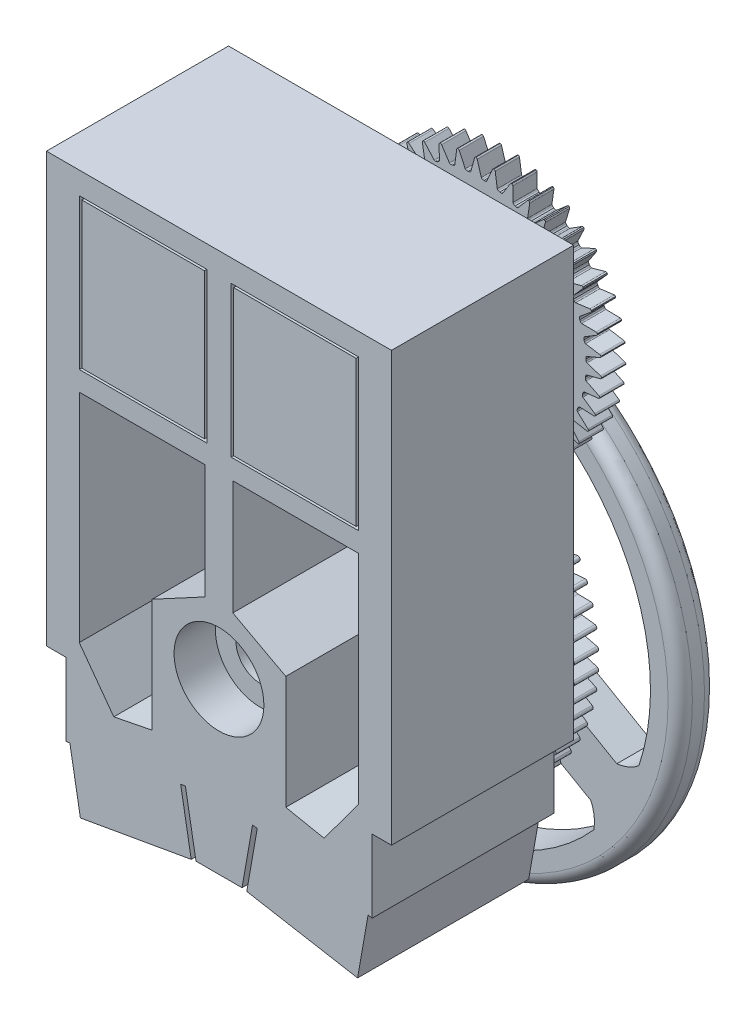
from build123d import *

# Parameters (mm, degrees)
SKETCH_1_R          = 2
SKETCH_1_W          = 10.5
SKETCH_1_H          = 12.4
EXTRUDE_1_DEPTH     = 15
SKETCH_2_R          = 3.7
CUT_EXTRUDE_1_DEPTH = 3.4
CUT_EXTRUDE_START   = -3.4
SKETCH_3_R          = 3.7
CUT_EXTRUDE_2_DEPTH = 3.4
CUT_EXTRUDE_4_DEPTH = 30
SKETCH_5_W          = 10.1
SKETCH_5_H          = 12
EXTRUDE_2_DEPTH     = 15
EXTRUDE_2_2_DEPTH   = 15
SKETCH_6_R          = 2
EXTRUDE_6_DEPTH     = 2
SKETCH_7_R          = 0.632337003
EXTRUDE_8_DEPTH     = 2
SKETCH_9_W          = 9.271295228
SKETCH_9_H          = 14.101544239
EXTRUDE_10_DEPTH    = 5
SKETCH_10_R         = 21
EXTRUDE_11_DEPTH    = 3
FILLET_1_R          = 1


with BuildPart() as part:
    # 草图1 → 凸台-拉伸1 (new body)
    with BuildSketch(Plane.XY):
        Polygon((14.213104702, -21.082041765), (12.6181085, -21.082041765), (12.6181085, -27.087928604), (2.76523262, -25.350600749), (1.896991732, -30.274639514), (-1.896991732, -30.274639514), (-2.76523262, -25.350600749), (-12.6181085, -27.087928604), (-12.6181085, -21.082041765), (-14.213104702, -21.082041765), (-14.213104702, -1.473791553), (-14.213104702, 14.225837354), (14.213104702, 14.225837354), (14.213104702, -1.473791553), align=None)
        with Locations((0, -16.345919829)):
            Circle(SKETCH_1_R, mode=Mode.SUBTRACT)
        with Locations((-6.25, 6.2)):
            Rectangle(SKETCH_1_W, SKETCH_1_H, mode=Mode.SUBTRACT)
        with Locations((6.25, 6.2)):
            Rectangle(SKETCH_1_W, SKETCH_1_H, mode=Mode.SUBTRACT)
    extrude(amount=EXTRUDE_1_DEPTH)

    # 草图2 → 切除-拉伸1 (cut)
    with BuildSketch(Plane.XY.offset(15)):
        with Locations((0, -16.345919829)):
            Circle(SKETCH_2_R)
    extrude(amount=-CUT_EXTRUDE_1_DEPTH, mode=Mode.SUBTRACT)

    # 草图3 → 切除-拉伸2 (cut)
    with BuildSketch(Plane(origin=(0, 0, 0), x_dir=(-1, 0, 0), z_dir=(0, 0, -1)).offset(CUT_EXTRUDE_START)):
        with Locations((0, -16.345919829)):
            Circle(SKETCH_3_R)
    extrude(amount=CUT_EXTRUDE_2_DEPTH, mode=Mode.SUBTRACT)

    # 草图4 → 切除-拉伸4 (cut)
    with BuildSketch(Plane.XY.offset(15)):
        Polygon((-11.511003594, -1.616213485), (-1.141020488, -1.616213485), (-1.141020488, -11.044647916), (-5.502192243, -13.390034656), (-5.502192243, -22.734353252), (-8.66548526, -23.361508048), (-11.511003594, -19.484677398), align=None)
        Polygon((5.502192243, -22.734353252), (8.66548526, -23.361508048), (11.511003594, -19.484677398), (11.511003594, -1.616213485), (1.141020488, -1.616213485), (1.141020488, -11.044647916), (5.502192243, -13.390034656), align=None)
    extrude(amount=-CUT_EXTRUDE_4_DEPTH, mode=Mode.SUBTRACT)

    # 草图9 → 凸台-拉伸10 (add)
    with BuildSketch(Plane(origin=(-4.251826085, -24.113303974, 0), x_dir=(0.9848077530122094, -0.1736481776669234, 0), z_dir=(-0.17364817766692336, -0.9848077530122092, 0))):
        with Locations((12.157249201, 7.949227881)):
            Rectangle(SKETCH_9_W, SKETCH_9_H)
    extrude_10 = extrude(amount=EXTRUDE_10_DEPTH)

    # 镜向4: 凸台-拉伸10 across plane
    add(extrude_10.mirror(Plane(origin=(0, 0, 0), x_dir=(0, 0, 1), z_dir=(1, 0, 0))))


with BuildPart() as body_2:
    # 草图5 → 凸台-拉伸2 (new body)
    with BuildSketch(Plane.XY):
        with Locations((-6.25, 6.2)):
            Rectangle(SKETCH_5_W, SKETCH_5_H)
    extrude(amount=EXTRUDE_2_DEPTH)


with BuildPart() as body_3:
    # 草图5 → Extrude 2 2 (new body)
    with BuildSketch(Plane.XY):
        with Locations((6.25, 6.2)):
            Rectangle(SKETCH_5_W, SKETCH_5_H)
    extrude(amount=EXTRUDE_2_2_DEPTH)


with BuildPart() as body_4:
    # 草图6 → 凸台-拉伸6 (new body)
    with BuildSketch(Plane(origin=(0, 0, 0), x_dir=(-1, 0, 0), z_dir=(0, 0, -1))):
        with BuildLine():
            Line((0.557442462, -2.188166105), (0.208308475, -3.18943574))
            ThreePointArc((0.208308475, -3.18943574), (0.130268656, -3.302440773), (0, -3.345919829))
            ThreePointArc((0, -3.345919829), (-0.130268656, -3.302440773), (-0.208308475, -3.18943574))
            Line((-0.208308475, -3.18943574), (-0.557442462, -2.188166105))
            ThreePointArc((-0.557442462, -2.188166105), (-0.748436646, -2.064897881), (-0.925499507, -2.207455158))
            Line((-0.925499507, -2.207455158), (-1.168059724, -3.239734171))
            ThreePointArc((-1.168059724, -3.239734171), (-1.233859791, -3.360277534), (-1.358870022, -3.417135189))
            ThreePointArc((-1.358870022, -3.417135189), (-1.492969852, -3.387511099), (-1.582394404, -3.283282501))
            Line((-1.582394404, -3.283282501), (-2.034276974, -2.323992365))
            ThreePointArc((-2.034276974, -2.323992365), (-2.23710991, -2.221363746), (-2.398301508, -2.381648188))
            Line((-2.398301508, -2.381648188), (-2.531630417, -3.433626715))
            ThreePointArc((-2.531630417, -3.433626715), (-2.584469811, -3.560387709), (-2.702851981, -3.630001019))
            ThreePointArc((-2.702851981, -3.630001019), (-2.839313758, -3.614556462), (-2.939143288, -3.52024625))
            Line((-2.939143288, -3.52024625), (-3.488823521, -2.613445797))
            ThreePointArc((-3.488823521, -2.613445797), (-3.701272929, -2.532581203), (-3.844827217, -2.7088367))
            Line((-3.844827217, -2.7088367), (-3.867464037, -3.768989045))
            ThreePointArc((-3.867464037, -3.768989045), (-3.90676384, -3.900578849), (-4.017220927, -3.982185117))
            ThreePointArc((-4.017220927, -3.982185117), (-4.154549548, -3.981089306), (-4.263690303, -3.897730763))
            Line((-4.263690303, -3.897730763), (-4.905145788, -3.053355088))
            ThreePointArc((-4.905145788, -3.053355088), (-5.124884028, -2.995140489), (-5.249228194, -3.185435949))
            Line((-5.249228194, -3.185435949), (-5.160924912, -4.242146861))
            ThreePointArc((-5.160924912, -4.242146861), (-5.186254546, -4.37712375), (-5.28757636, -4.469828879))
            ThreePointArc((-5.28757636, -4.469828879), (-5.424267224, -4.483093822), (-5.541523435, -4.41160024))
            Line((-5.541523435, -4.41160024), (-6.267726252, -3.6389005))
            ThreePointArc((-6.267726252, -3.6389005), (-6.492345825, -3.603973707), (-6.596117529, -3.806224213))
            Line((-6.596117529, -3.806224213), (-6.397841613, -4.847916145))
            ThreePointArc((-6.397841613, -4.847916145), (-6.408923562, -4.984801285), (-6.5, -5.087589579))
            ThreePointArc((-6.5, -5.087589579), (-6.634555493, -5.115069941), (-6.758642476, -5.056224621))
            Line((-6.758642476, -5.056224621), (-7.561636195, -4.363666674))
            ThreePointArc((-7.561636195, -4.363666674), (-7.788676122, -4.352410353), (-7.870738419, -4.564400006))
            Line((-7.870738419, -4.564400006), (-7.564662223, -5.579659965))
            ThreePointArc((-7.564662223, -5.579659965), (-7.561375071, -5.716953612), (-7.64120828, -5.828698902))
            ThreePointArc((-7.64120828, -5.828698902), (-7.772154184, -5.870093602), (-7.901712416, -5.824541264))
            Line((-7.901712416, -5.824541264), (-8.772699269, -5.219712922))
            ThreePointArc((-8.772699269, -5.219712922), (-8.999672054, -5.232250399), (-9.059125853, -5.451656596))
            Line((-9.059125853, -5.451656596), (-8.648602811, -6.42936118))
            ThreePointArc((-8.648602811, -6.42936118), (-8.630982572, -6.565559118), (-8.698697883, -6.685037097))
            ThreePointArc((-8.698697883, -6.685037097), (-8.824599527, -6.739892607), (-8.958209542, -6.708132333))
            Line((-8.958209542, -6.708132333), (-9.887646815, -6.197660221))
            ThreePointArc((-9.887646815, -6.197660221), (-10.112065696, -6.233854133), (-10.148259608, -6.458273014))
            Line((-10.148259608, -6.458273014), (-9.637787496, -7.387710287))
            ThreePointArc((-9.637787496, -7.387710287), (-9.606027221, -7.521320302), (-9.660882731, -7.647221946))
            ThreePointArc((-9.660882731, -7.647221946), (-9.780360711, -7.714937257), (-9.916558649, -7.697317018))
            Line((-9.916558649, -7.697317018), (-10.894263232, -7.286793976))
            ThreePointArc((-10.894263232, -7.286793976), (-11.11366943, -7.346247774), (-11.126206907, -7.57322056))
            Line((-11.126206907, -7.57322056), (-10.521378565, -8.444207412))
            ThreePointArc((-10.521378565, -8.444207412), (-10.475826227, -8.573765645), (-10.517220927, -8.704711549))
            ThreePointArc((-10.517220927, -8.704711549), (-10.628966217, -8.784544758), (-10.766259864, -8.781257606))
            Line((-10.766259864, -8.781257606), (-11.781519822, -8.475181409))
            ThreePointArc((-11.781519822, -8.475181409), (-11.993509475, -8.557243706), (-11.982253154, -8.784283634))
            Line((-11.982253154, -8.784283634), (-11.289695208, -9.587277353))
            ThreePointArc((-11.289695208, -9.587277353), (-11.230849888, -9.711364335), (-11.258330249, -9.845919829))
            ThreePointArc((-11.258330249, -9.845919829), (-11.361118544, -9.936996266), (-11.498003683, -9.948078216))
            Line((-11.498003683, -9.948078216), (-12.539695616, -9.7498023))
            ThreePointArc((-12.539695616, -9.7498023), (-12.741946122, -9.853574004), (-12.707019329, -10.078193577))
            Line((-12.707019329, -10.078193577), (-11.934319588, -10.804396394))
            ThreePointArc((-11.934319588, -10.804396394), (-11.862826007, -10.921652605), (-11.876090949, -11.058343469))
            ThreePointArc((-11.876090949, -11.058343469), (-11.968796079, -11.159665283), (-12.103772968, -11.184994917))
            Line((-12.103772968, -11.184994917), (-13.16048388, -11.096691634))
            ThreePointArc((-13.16048388, -11.096691634), (-13.35077934, -11.221035801), (-13.292564741, -11.44077404))
            Line((-13.292564741, -11.44077404), (-12.448189066, -12.082229526))
            ThreePointArc((-12.448189066, -12.082229526), (-12.364830522, -12.19137028), (-12.363734712, -12.328698902))
            ThreePointArc((-12.363734712, -12.328698902), (-12.445340979, -12.439155989), (-12.576930783, -12.478455792))
            Line((-12.576930783, -12.478455792), (-13.637083129, -12.501092611))
            ThreePointArc((-13.637083129, -12.501092611), (-13.813338625, -12.644646899), (-13.732474032, -12.857096307))
            Line((-13.732474032, -12.857096307), (-12.825673579, -13.406776541))
            ThreePointArc((-12.825673579, -13.406776541), (-12.731363367, -13.506606071), (-12.71591881, -13.643067848))
            ThreePointArc((-12.71591881, -13.643067848), (-12.78553212, -13.761450017), (-12.912293113, -13.814289412))
            Line((-12.912293113, -13.814289412), (-13.964271641, -13.94761832))
            ThreePointArc((-13.964271641, -13.94761832), (-14.124556082, -14.108809919), (-14.021927463, -14.311642855))
            Line((-14.021927463, -14.311642855), (-13.062637328, -14.763525425))
            ThreePointArc((-13.062637328, -14.763525425), (-12.95840873, -14.852949977), (-12.92878464, -14.987049806))
            ThreePointArc((-12.92878464, -14.987049806), (-12.985642295, -15.112060038), (-13.106185657, -15.177860105))
            Line((-13.106185657, -15.177860105), (-14.138464671, -15.420420322))
            ThreePointArc((-14.138464671, -15.420420322), (-14.281021947, -15.597483182), (-14.157753723, -15.788477367))
            Line((-14.157753723, -15.788477367), (-13.156484089, -16.137611353))
            ThreePointArc((-13.156484089, -16.137611353), (-13.043479055, -16.215651173), (-13, -16.345919829))
            ThreePointArc((-13, -16.345919829), (-13.043479055, -16.476188485), (-13.156484089, -16.554228304))
            Line((-13.156484089, -16.554228304), (-14.157753723, -16.90336229))
            ThreePointArc((-14.157753723, -16.90336229), (-14.281021947, -17.094356475), (-14.138464671, -17.271419335))
            Line((-14.138464671, -17.271419335), (-13.106185657, -17.513979553))
            ThreePointArc((-13.106185657, -17.513979553), (-12.985642295, -17.579779619), (-12.92878464, -17.704789851))
            ThreePointArc((-12.92878464, -17.704789851), (-12.95840873, -17.838889681), (-13.062637328, -17.928314232))
            Line((-13.062637328, -17.928314232), (-14.021927463, -18.380196802))
            ThreePointArc((-14.021927463, -18.380196802), (-14.124556082, -18.583029739), (-13.964271641, -18.744221337))
            Line((-13.964271641, -18.744221337), (-12.912293113, -18.877550245))
            ThreePointArc((-12.912293113, -18.877550245), (-12.78553212, -18.93038964), (-12.71591881, -19.048771809))
            ThreePointArc((-12.71591881, -19.048771809), (-12.731363367, -19.185233587), (-12.825673579, -19.285063116))
            Line((-12.825673579, -19.285063116), (-13.732474032, -19.83474335))
            ThreePointArc((-13.732474032, -19.83474335), (-13.813338625, -20.047192758), (-13.637083129, -20.190747046))
            Line((-13.637083129, -20.190747046), (-12.576930783, -20.213383866))
            ThreePointArc((-12.576930783, -20.213383866), (-12.445340979, -20.252683668), (-12.363734712, -20.363140756))
            ThreePointArc((-12.363734712, -20.363140756), (-12.364830522, -20.500469377), (-12.448189066, -20.609610131))
            Line((-12.448189066, -20.609610131), (-13.292564741, -21.251065617))
            ThreePointArc((-13.292564741, -21.251065617), (-13.35077934, -21.470803857), (-13.16048388, -21.595148023))
            Line((-13.16048388, -21.595148023), (-12.103772968, -21.50684474))
            ThreePointArc((-12.103772968, -21.50684474), (-11.968796079, -21.532174375), (-11.876090949, -21.633496189))
            ThreePointArc((-11.876090949, -21.633496189), (-11.862826007, -21.770187053), (-11.934319588, -21.887443263))
            Line((-11.934319588, -21.887443263), (-12.707019329, -22.61364608))
            ThreePointArc((-12.707019329, -22.61364608), (-12.741946122, -22.838265654), (-12.539695616, -22.942037357))
            Line((-12.539695616, -22.942037357), (-11.498003683, -22.743761442))
            ThreePointArc((-11.498003683, -22.743761442), (-11.361118544, -22.754843391), (-11.258330249, -22.845919829))
            ThreePointArc((-11.258330249, -22.845919829), (-11.230849888, -22.980475322), (-11.289695208, -23.104562305))
            Line((-11.289695208, -23.104562305), (-11.982253154, -23.907556023))
            ThreePointArc((-11.982253154, -23.907556023), (-11.993509475, -24.134595951), (-11.781519822, -24.216658248))
            Line((-11.781519822, -24.216658248), (-10.766259864, -23.910582052))
            ThreePointArc((-10.766259864, -23.910582052), (-10.628966217, -23.907294899), (-10.517220927, -23.987128108))
            ThreePointArc((-10.517220927, -23.987128108), (-10.475826227, -24.118074013), (-10.521378565, -24.247632245))
            Line((-10.521378565, -24.247632245), (-11.126206907, -25.118619098))
            ThreePointArc((-11.126206907, -25.118619098), (-11.11366943, -25.345591883), (-10.894263232, -25.405045681))
            Line((-10.894263232, -25.405045681), (-9.916558649, -24.994522639))
            ThreePointArc((-9.916558649, -24.994522639), (-9.780360711, -24.9769024), (-9.660882731, -25.044617711))
            ThreePointArc((-9.660882731, -25.044617711), (-9.606027221, -25.170519356), (-9.637787496, -25.30412937))
            Line((-9.637787496, -25.30412937), (-10.148259608, -26.233566643))
            ThreePointArc((-10.148259608, -26.233566643), (-10.112065696, -26.457985525), (-9.887646815, -26.494179436))
            Line((-9.887646815, -26.494179436), (-8.958209542, -25.983707325))
            ThreePointArc((-8.958209542, -25.983707325), (-8.824599527, -25.95194705), (-8.698697883, -26.00680256))
            ThreePointArc((-8.698697883, -26.00680256), (-8.630982572, -26.12628054), (-8.648602811, -26.262478477))
            Line((-8.648602811, -26.262478477), (-9.059125853, -27.240183061))
            ThreePointArc((-9.059125853, -27.240183061), (-8.999672054, -27.459589258), (-8.772699269, -27.472126735))
            Line((-8.772699269, -27.472126735), (-7.901712416, -26.867298393))
            ThreePointArc((-7.901712416, -26.867298393), (-7.772154184, -26.821746055), (-7.64120828, -26.863140756))
            ThreePointArc((-7.64120828, -26.863140756), (-7.561375071, -26.974886045), (-7.564662223, -27.112179693))
            Line((-7.564662223, -27.112179693), (-7.870738419, -28.127439651))
            ThreePointArc((-7.870738419, -28.127439651), (-7.788676122, -28.339429304), (-7.561636195, -28.328172983))
            Line((-7.561636195, -28.328172983), (-6.758642476, -27.635615037))
            ThreePointArc((-6.758642476, -27.635615037), (-6.634555493, -27.576769716), (-6.5, -27.604250078))
            ThreePointArc((-6.5, -27.604250078), (-6.408923562, -27.707038372), (-6.397841613, -27.843923512))
            Line((-6.397841613, -27.843923512), (-6.596117529, -28.885615445))
            ThreePointArc((-6.596117529, -28.885615445), (-6.492345825, -29.08786595), (-6.267726252, -29.052939158))
            Line((-6.267726252, -29.052939158), (-5.541523435, -28.280239417))
            ThreePointArc((-5.541523435, -28.280239417), (-5.424267224, -28.208745836), (-5.28757636, -28.222010778))
            ThreePointArc((-5.28757636, -28.222010778), (-5.186254546, -28.314715907), (-5.160924912, -28.449692797))
            Line((-5.160924912, -28.449692797), (-5.249228194, -29.506403709))
            ThreePointArc((-5.249228194, -29.506403709), (-5.124884028, -29.696699168), (-4.905145788, -29.638484569))
            Line((-4.905145788, -29.638484569), (-4.263690303, -28.794108894))
            ThreePointArc((-4.263690303, -28.794108894), (-4.154549548, -28.710750351), (-4.017220927, -28.70965454))
            ThreePointArc((-4.017220927, -28.70965454), (-3.90676384, -28.791260808), (-3.867464037, -28.922850612))
            Line((-3.867464037, -28.922850612), (-3.844827217, -29.983002957))
            ThreePointArc((-3.844827217, -29.983002957), (-3.701272929, -30.159258454), (-3.488823521, -30.07839386))
            Line((-3.488823521, -30.07839386), (-2.939143288, -29.171593407))
            ThreePointArc((-2.939143288, -29.171593407), (-2.839313758, -29.077283195), (-2.702851981, -29.061838638))
            ThreePointArc((-2.702851981, -29.061838638), (-2.584469811, -29.131451948), (-2.531630417, -29.258212942))
            Line((-2.531630417, -29.258212942), (-2.398301508, -30.31019147))
            ThreePointArc((-2.398301508, -30.31019147), (-2.23710991, -30.470475911), (-2.034276974, -30.367847292))
            Line((-2.034276974, -30.367847292), (-1.582394404, -29.408557157))
            ThreePointArc((-1.582394404, -29.408557157), (-1.492969852, -29.304328559), (-1.358870022, -29.274704468))
            ThreePointArc((-1.358870022, -29.274704468), (-1.233859791, -29.331562123), (-1.168059724, -29.452105486))
            Line((-1.168059724, -29.452105486), (-0.925499507, -30.4843845))
            ThreePointArc((-0.925499507, -30.4843845), (-0.748436646, -30.626941776), (-0.557442462, -30.503673552))
            Line((-0.557442462, -30.503673552), (-0.208308475, -29.502403918))
            ThreePointArc((-0.208308475, -29.502403918), (-0.130268656, -29.389398884), (0, -29.345919829))
            ThreePointArc((0, -29.345919829), (0.130268656, -29.389398884), (0.208308475, -29.502403918))
            Line((0.208308475, -29.502403918), (0.557442462, -30.503673552))
            ThreePointArc((0.557442462, -30.503673552), (0.748436646, -30.626941776), (0.925499507, -30.4843845))
            Line((0.925499507, -30.4843845), (1.168059724, -29.452105486))
            ThreePointArc((1.168059724, -29.452105486), (1.233859791, -29.331562123), (1.358870022, -29.274704468))
            ThreePointArc((1.358870022, -29.274704468), (1.492969852, -29.304328559), (1.582394404, -29.408557157))
            Line((1.582394404, -29.408557157), (2.034276974, -30.367847292))
            ThreePointArc((2.034276974, -30.367847292), (2.23710991, -30.470475911), (2.398301508, -30.31019147))
            Line((2.398301508, -30.31019147), (2.531630417, -29.258212942))
            ThreePointArc((2.531630417, -29.258212942), (2.584469811, -29.131451948), (2.702851981, -29.061838638))
            ThreePointArc((2.702851981, -29.061838638), (2.839313758, -29.077283195), (2.939143288, -29.171593407))
            Line((2.939143288, -29.171593407), (3.488823521, -30.07839386))
            ThreePointArc((3.488823521, -30.07839386), (3.701272929, -30.159258454), (3.844827217, -29.983002957))
            Line((3.844827217, -29.983002957), (3.867464037, -28.922850612))
            ThreePointArc((3.867464037, -28.922850612), (3.90676384, -28.791260808), (4.017220927, -28.70965454))
            ThreePointArc((4.017220927, -28.70965454), (4.154549548, -28.710750351), (4.263690303, -28.794108894))
            Line((4.263690303, -28.794108894), (4.905145788, -29.638484569))
            ThreePointArc((4.905145788, -29.638484569), (5.124884028, -29.696699168), (5.249228194, -29.506403709))
            Line((5.249228194, -29.506403709), (5.160924912, -28.449692797))
            ThreePointArc((5.160924912, -28.449692797), (5.186254546, -28.314715907), (5.28757636, -28.222010778))
            ThreePointArc((5.28757636, -28.222010778), (5.424267224, -28.208745836), (5.541523435, -28.280239417))
            Line((5.541523435, -28.280239417), (6.267726252, -29.052939158))
            ThreePointArc((6.267726252, -29.052939158), (6.492345825, -29.08786595), (6.596117529, -28.885615445))
            Line((6.596117529, -28.885615445), (6.397841613, -27.843923512))
            ThreePointArc((6.397841613, -27.843923512), (6.408923562, -27.707038372), (6.5, -27.604250078))
            ThreePointArc((6.5, -27.604250078), (6.634555493, -27.576769716), (6.758642476, -27.635615037))
            Line((6.758642476, -27.635615037), (7.561636195, -28.328172983))
            ThreePointArc((7.561636195, -28.328172983), (7.788676122, -28.339429304), (7.870738419, -28.127439651))
            Line((7.870738419, -28.127439651), (7.564662223, -27.112179693))
            ThreePointArc((7.564662223, -27.112179693), (7.561375071, -26.974886045), (7.64120828, -26.863140756))
            ThreePointArc((7.64120828, -26.863140756), (7.772154184, -26.821746055), (7.901712416, -26.867298393))
            Line((7.901712416, -26.867298393), (8.772699269, -27.472126735))
            ThreePointArc((8.772699269, -27.472126735), (8.999672054, -27.459589258), (9.059125853, -27.240183061))
            Line((9.059125853, -27.240183061), (8.648602811, -26.262478477))
            ThreePointArc((8.648602811, -26.262478477), (8.630982572, -26.12628054), (8.698697883, -26.00680256))
            ThreePointArc((8.698697883, -26.00680256), (8.824599527, -25.95194705), (8.958209542, -25.983707325))
            Line((8.958209542, -25.983707325), (9.887646815, -26.494179436))
            ThreePointArc((9.887646815, -26.494179436), (10.112065696, -26.457985525), (10.148259608, -26.233566643))
            Line((10.148259608, -26.233566643), (9.637787496, -25.30412937))
            ThreePointArc((9.637787496, -25.30412937), (9.606027221, -25.170519356), (9.660882731, -25.044617711))
            ThreePointArc((9.660882731, -25.044617711), (9.780360711, -24.9769024), (9.916558649, -24.994522639))
            Line((9.916558649, -24.994522639), (10.894263232, -25.405045681))
            ThreePointArc((10.894263232, -25.405045681), (11.11366943, -25.345591883), (11.126206907, -25.118619098))
            Line((11.126206907, -25.118619098), (10.521378565, -24.247632245))
            ThreePointArc((10.521378565, -24.247632245), (10.475826227, -24.118074013), (10.517220927, -23.987128108))
            ThreePointArc((10.517220927, -23.987128108), (10.628966217, -23.907294899), (10.766259864, -23.910582052))
            Line((10.766259864, -23.910582052), (11.781519822, -24.216658248))
            ThreePointArc((11.781519822, -24.216658248), (11.993509475, -24.134595951), (11.982253154, -23.907556023))
            Line((11.982253154, -23.907556023), (11.289695208, -23.104562305))
            ThreePointArc((11.289695208, -23.104562305), (11.230849888, -22.980475322), (11.258330249, -22.845919829))
            ThreePointArc((11.258330249, -22.845919829), (11.361118544, -22.754843391), (11.498003683, -22.743761442))
            Line((11.498003683, -22.743761442), (12.539695616, -22.942037357))
            ThreePointArc((12.539695616, -22.942037357), (12.741946122, -22.838265654), (12.707019329, -22.61364608))
            Line((12.707019329, -22.61364608), (11.934319588, -21.887443263))
            ThreePointArc((11.934319588, -21.887443263), (11.862826007, -21.770187053), (11.876090949, -21.633496189))
            ThreePointArc((11.876090949, -21.633496189), (11.968796079, -21.532174375), (12.103772968, -21.50684474))
            Line((12.103772968, -21.50684474), (13.16048388, -21.595148023))
            ThreePointArc((13.16048388, -21.595148023), (13.35077934, -21.470803857), (13.292564741, -21.251065617))
            Line((13.292564741, -21.251065617), (12.448189066, -20.609610131))
            ThreePointArc((12.448189066, -20.609610131), (12.364830522, -20.500469377), (12.363734712, -20.363140756))
            ThreePointArc((12.363734712, -20.363140756), (12.445340979, -20.252683668), (12.576930783, -20.213383866))
            Line((12.576930783, -20.213383866), (13.637083129, -20.190747046))
            ThreePointArc((13.637083129, -20.190747046), (13.813338625, -20.047192758), (13.732474032, -19.83474335))
            Line((13.732474032, -19.83474335), (12.825673579, -19.285063116))
            ThreePointArc((12.825673579, -19.285063116), (12.731363367, -19.185233587), (12.71591881, -19.048771809))
            ThreePointArc((12.71591881, -19.048771809), (12.78553212, -18.93038964), (12.912293113, -18.877550245))
            Line((12.912293113, -18.877550245), (13.964271641, -18.744221337))
            ThreePointArc((13.964271641, -18.744221337), (14.124556082, -18.583029739), (14.021927463, -18.380196802))
            Line((14.021927463, -18.380196802), (13.062637328, -17.928314232))
            ThreePointArc((13.062637328, -17.928314232), (12.95840873, -17.838889681), (12.92878464, -17.704789851))
            ThreePointArc((12.92878464, -17.704789851), (12.985642295, -17.579779619), (13.106185657, -17.513979553))
            Line((13.106185657, -17.513979553), (14.138464671, -17.271419335))
            ThreePointArc((14.138464671, -17.271419335), (14.281021947, -17.094356475), (14.157753723, -16.90336229))
            Line((14.157753723, -16.90336229), (13.156484089, -16.554228304))
            ThreePointArc((13.156484089, -16.554228304), (13.043479055, -16.476188485), (13, -16.345919829))
            ThreePointArc((13, -16.345919829), (13.043479055, -16.215651173), (13.156484089, -16.137611353))
            Line((13.156484089, -16.137611353), (14.157753723, -15.788477367))
            ThreePointArc((14.157753723, -15.788477367), (14.281021947, -15.597483182), (14.138464671, -15.420420322))
            Line((14.138464671, -15.420420322), (13.106185657, -15.177860105))
            ThreePointArc((13.106185657, -15.177860105), (12.985642295, -15.112060038), (12.92878464, -14.987049806))
            ThreePointArc((12.92878464, -14.987049806), (12.95840873, -14.852949977), (13.062637328, -14.763525425))
            Line((13.062637328, -14.763525425), (14.021927463, -14.311642855))
            ThreePointArc((14.021927463, -14.311642855), (14.124556082, -14.108809919), (13.964271641, -13.94761832))
            Line((13.964271641, -13.94761832), (12.912293113, -13.814289412))
            ThreePointArc((12.912293113, -13.814289412), (12.78553212, -13.761450017), (12.71591881, -13.643067848))
            ThreePointArc((12.71591881, -13.643067848), (12.731363367, -13.506606071), (12.825673579, -13.406776541))
            Line((12.825673579, -13.406776541), (13.732474032, -12.857096307))
            ThreePointArc((13.732474032, -12.857096307), (13.813338625, -12.644646899), (13.637083129, -12.501092611))
            Line((13.637083129, -12.501092611), (12.576930783, -12.478455792))
            ThreePointArc((12.576930783, -12.478455792), (12.445340979, -12.439155989), (12.363734712, -12.328698902))
            ThreePointArc((12.363734712, -12.328698902), (12.364830522, -12.19137028), (12.448189066, -12.082229526))
            Line((12.448189066, -12.082229526), (13.292564741, -11.44077404))
            ThreePointArc((13.292564741, -11.44077404), (13.35077934, -11.221035801), (13.16048388, -11.096691634))
            Line((13.16048388, -11.096691634), (12.103772968, -11.184994917))
            ThreePointArc((12.103772968, -11.184994917), (11.968796079, -11.159665283), (11.876090949, -11.058343469))
            ThreePointArc((11.876090949, -11.058343469), (11.862826007, -10.921652605), (11.934319588, -10.804396394))
            Line((11.934319588, -10.804396394), (12.707019329, -10.078193577))
            ThreePointArc((12.707019329, -10.078193577), (12.741946122, -9.853574004), (12.539695616, -9.7498023))
            Line((12.539695616, -9.7498023), (11.498003683, -9.948078216))
            ThreePointArc((11.498003683, -9.948078216), (11.361118544, -9.936996266), (11.258330249, -9.845919829))
            ThreePointArc((11.258330249, -9.845919829), (11.230849888, -9.711364335), (11.289695208, -9.587277353))
            Line((11.289695208, -9.587277353), (11.982253154, -8.784283634))
            ThreePointArc((11.982253154, -8.784283634), (11.993509475, -8.557243706), (11.781519822, -8.475181409))
            Line((11.781519822, -8.475181409), (10.766259864, -8.781257606))
            ThreePointArc((10.766259864, -8.781257606), (10.628966217, -8.784544758), (10.517220927, -8.704711549))
            ThreePointArc((10.517220927, -8.704711549), (10.475826227, -8.573765645), (10.521378565, -8.444207412))
            Line((10.521378565, -8.444207412), (11.126206907, -7.57322056))
            ThreePointArc((11.126206907, -7.57322056), (11.11366943, -7.346247774), (10.894263232, -7.286793976))
            Line((10.894263232, -7.286793976), (9.916558649, -7.697317018))
            ThreePointArc((9.916558649, -7.697317018), (9.780360711, -7.714937257), (9.660882731, -7.647221946))
            ThreePointArc((9.660882731, -7.647221946), (9.606027221, -7.521320302), (9.637787496, -7.387710287))
            Line((9.637787496, -7.387710287), (10.148259608, -6.458273014))
            ThreePointArc((10.148259608, -6.458273014), (10.112065696, -6.233854133), (9.887646815, -6.197660221))
            Line((9.887646815, -6.197660221), (8.958209542, -6.708132333))
            ThreePointArc((8.958209542, -6.708132333), (8.824599527, -6.739892607), (8.698697883, -6.685037097))
            ThreePointArc((8.698697883, -6.685037097), (8.630982572, -6.565559118), (8.648602811, -6.42936118))
            Line((8.648602811, -6.42936118), (9.059125853, -5.451656596))
            ThreePointArc((9.059125853, -5.451656596), (8.999672054, -5.232250399), (8.772699269, -5.219712922))
            Line((8.772699269, -5.219712922), (7.901712416, -5.824541264))
            ThreePointArc((7.901712416, -5.824541264), (7.772154184, -5.870093602), (7.64120828, -5.828698902))
            ThreePointArc((7.64120828, -5.828698902), (7.561375071, -5.716953612), (7.564662223, -5.579659965))
            Line((7.564662223, -5.579659965), (7.870738419, -4.564400006))
            ThreePointArc((7.870738419, -4.564400006), (7.788676122, -4.352410353), (7.561636195, -4.363666674))
            Line((7.561636195, -4.363666674), (6.758642476, -5.056224621))
            ThreePointArc((6.758642476, -5.056224621), (6.634555493, -5.115069941), (6.5, -5.087589579))
            ThreePointArc((6.5, -5.087589579), (6.408923562, -4.984801285), (6.397841613, -4.847916145))
            Line((6.397841613, -4.847916145), (6.596117529, -3.806224213))
            ThreePointArc((6.596117529, -3.806224213), (6.492345825, -3.603973707), (6.267726252, -3.6389005))
            Line((6.267726252, -3.6389005), (5.541523435, -4.41160024))
            ThreePointArc((5.541523435, -4.41160024), (5.424267224, -4.483093822), (5.28757636, -4.469828879))
            ThreePointArc((5.28757636, -4.469828879), (5.186254546, -4.37712375), (5.160924912, -4.242146861))
            Line((5.160924912, -4.242146861), (5.249228194, -3.185435949))
            ThreePointArc((5.249228194, -3.185435949), (5.124884028, -2.995140489), (4.905145788, -3.053355088))
            Line((4.905145788, -3.053355088), (4.263690303, -3.897730763))
            ThreePointArc((4.263690303, -3.897730763), (4.154549548, -3.981089306), (4.017220927, -3.982185117))
            ThreePointArc((4.017220927, -3.982185117), (3.90676384, -3.900578849), (3.867464037, -3.768989045))
            Line((3.867464037, -3.768989045), (3.844827217, -2.7088367))
            ThreePointArc((3.844827217, -2.7088367), (3.701272929, -2.532581203), (3.488823521, -2.613445797))
            Line((3.488823521, -2.613445797), (2.939143288, -3.52024625))
            ThreePointArc((2.939143288, -3.52024625), (2.839313758, -3.614556462), (2.702851981, -3.630001019))
            ThreePointArc((2.702851981, -3.630001019), (2.584469811, -3.560387709), (2.531630417, -3.433626715))
            Line((2.531630417, -3.433626715), (2.398301508, -2.381648188))
            ThreePointArc((2.398301508, -2.381648188), (2.23710991, -2.221363746), (2.034276974, -2.323992365))
            Line((2.034276974, -2.323992365), (1.582394404, -3.283282501))
            ThreePointArc((1.582394404, -3.283282501), (1.492969852, -3.387511099), (1.358870022, -3.417135189))
            ThreePointArc((1.358870022, -3.417135189), (1.233859791, -3.360277534), (1.168059724, -3.239734171))
            Line((1.168059724, -3.239734171), (0.925499507, -2.207455158))
            ThreePointArc((0.925499507, -2.207455158), (0.748436646, -2.064897881), (0.557442462, -2.188166105))
        make_face()
        with Locations((0, -16.345919829)):
            Circle(SKETCH_6_R, mode=Mode.SUBTRACT)
    extrude(amount=EXTRUDE_6_DEPTH)


with BuildPart() as body_5:
    # 草图7 → 凸台-拉伸8 (new body)
    with BuildSketch(Plane(origin=(0, 0, 0), x_dir=(-1, 0, 0), z_dir=(0, 0, -1))):
        with BuildLine():
            ThreePointArc((-4.887800391, -2.693136084), (-4.825644916, -2.70729745), (-4.775758529, -2.746986187))
            Line((-4.775758529, -2.746986187), (-4.218362124, -3.784403001))
            ThreePointArc((-4.218362124, -3.784403001), (-4.166914491, -3.835649268), (-4.09581457, -3.850408672))
            ThreePointArc((-4.09581457, -3.850408672), (-4.037009591, -3.8078057), (-4.011084575, -3.739975526))
            Line((-4.011084575, -3.739975526), (-3.927835816, -2.56524405))
            ThreePointArc((-3.927835816, -2.56524405), (-3.898598073, -2.508595998), (-3.847706703, -2.470204386))
            Line((-3.847706703, -2.470204386), (-3.73246244, -2.418423038))
            Line((-3.73246244, -2.418423038), (-3.607465852, -2.400027352))
            ThreePointArc((-3.607465852, -2.400027352), (-3.543910833, -2.404987896), (-3.488777341, -2.436990169))
            Line((-3.488777341, -2.436990169), (-2.786271805, -3.382194046))
            ThreePointArc((-2.786271805, -3.382194046), (-2.727910914, -3.425403365), (-2.655419692, -3.429653252))
            ThreePointArc((-2.655419692, -3.429653252), (-2.603444419, -3.37894221), (-2.587671829, -3.308060165))
            Line((-2.587671829, -3.308060165), (-2.676352496, -2.133726253))
            ThreePointArc((-2.676352496, -2.133726253), (-2.655674351, -2.073424829), (-2.610915175, -2.0280325))
            Line((-2.610915175, -2.0280325), (-2.504438453, -1.960023267))
            Line((-2.504438453, -1.960023267), (-2.383452341, -1.923623969))
            ThreePointArc((-2.383452341, -1.923623969), (-2.319852344, -1.919277965), (-2.26064682, -1.9429117))
            Line((-2.26064682, -1.9429117), (-1.428004839, -2.775757261))
            ThreePointArc((-1.428004839, -2.775757261), (-1.363974551, -2.810008701), (-1.291637053, -2.803658492))
            ThreePointArc((-1.291637053, -2.803658492), (-1.247599248, -2.745920198), (-1.242315249, -2.67349701))
            Line((-1.242315249, -2.67349701), (-1.501035268, -1.52458955))
            ThreePointArc((-1.501035268, -1.52458955), (-1.48935744, -1.461919974), (-1.451684422, -1.410494386))
            Line((-1.451684422, -1.410494386), (-1.356244607, -1.327706767))
            Line((-1.356244607, -1.327706767), (-1.24184758, -1.274079644))
            ThreePointArc((-1.24184758, -1.274079644), (-1.179558128, -1.26051972), (-1.117542437, -1.275281206))
            Line((-1.117542437, -1.275281206), (-0.172510328, -1.978017793))
            ThreePointArc((-0.172510328, -1.978017793), (-0.104175338, -2.002581343), (-0.033533311, -1.985766382))
            ThreePointArc((-0.033533311, -1.985766382), (0.001628436, -1.922231428), (-0.003688776, -1.849810671))
            Line((-0.003688776, -1.849810671), (-0.426933979, -0.750816632))
            ThreePointArc((-0.426933979, -0.750816632), (-0.424505361, -0.687114598), (-0.394721436, -0.630751798))
            Line((-0.394721436, -0.630751798), (-0.312352661, -0.534950267))
            Line((-0.312352661, -0.534950267), (-0.206982893, -0.465238288))
            ThreePointArc((-0.206982893, -0.465238288), (-0.147331577, -0.44275345), (-0.083827475, -0.448328071))
            Line((-0.083827475, -0.448328071), (0.953453042, -1.005978074))
            ThreePointArc((0.953453042, -1.005978074), (1.024636293, -1.020330206), (1.092077235, -0.993408873))
            ThreePointArc((1.092077235, -0.993408873), (1.117613513, -0.925431397), (1.101808418, -0.854556593))
            Line((1.101808418, -0.854556593), (0.523058769, 0.171100875))
            ThreePointArc((0.523058769, 0.171100875), (0.516186415, 0.23447767), (0.537446454, 0.294576406))
            Line((0.537446454, 0.294576406), (0.60498864, 0.401350005))
            Line((0.60498864, 0.401350005), (0.699085376, 0.485661051))
            ThreePointArc((0.699085376, 0.485661051), (0.754827191, 0.516591577), (0.818466225, 0.520322634))
            Line((0.818466225, 0.520322634), (1.925887317, 0.119644556))
            ThreePointArc((1.925887317, 0.119644556), (1.998401681, 0.115809735), (2.061204153, 0.152263656))
            ThreePointArc((2.061204153, 0.152263656), (2.0765707, 0.223234834), (2.05061458, 0.291053111))
            Line((2.05061458, 0.291053111), (1.328695527, 1.221513899))
            ThreePointArc((1.328695527, 1.221513899), (1.312668674, 1.283214689), (1.324951707, 1.345768462))
            Line((1.324951707, 1.345768462), (1.37622776, 1.461238434))
            Line((1.37622776, 1.461238434), (1.457045955, 1.558351603))
            ThreePointArc((1.457045955, 1.558351603), (1.507690229, 1.597068588), (1.570107839, 1.610025802))
            Line((1.570107839, 1.610025802), (2.724066748, 1.374859407))
            ThreePointArc((2.724066748, 1.374859407), (2.796366708, 1.381623628), (2.853192183, 1.426833186))
            ThreePointArc((2.853192183, 1.426833186), (2.858061488, 1.499285438), (2.822507553, 1.562601758))
            Line((2.822507553, 1.562601758), (1.972805548, 2.378034712))
            ThreePointArc((1.972805548, 2.378034712), (1.947965781, 2.43674445), (1.951010015, 2.500420034))
            Line((1.951010015, 2.500420034), (1.984927075, 2.622125339))
            Line((1.984927075, 2.622125339), (2.050744229, 2.729970833))
            ThreePointArc((2.050744229, 2.729970833), (2.095211568, 2.77564909), (2.155077431, 2.797556301))
            Line((2.155077431, 2.797556301), (3.330979527, 2.732913752))
            ThreePointArc((3.330979527, 2.732913752), (3.401524134, 2.750132848), (3.451161476, 2.80313448))
            ThreePointArc((3.451161476, 2.80313448), (3.445429759, 2.875523611), (3.401035778, 2.932988498))
            Line((3.401035778, 2.932988498), (2.441660745, 3.616014079))
            ThreePointArc((2.441660745, 3.616014079), (2.408537479, 3.67048147), (2.402278033, 3.733921731))
            Line((2.402278033, 3.733921731), (2.418113217, 3.859268431))
            Line((2.418113217, 3.859268431), (2.467526552, 3.975547709))
            ThreePointArc((2.467526552, 3.975547709), (2.504869211, 4.027213686), (2.56090739, 4.05760398))
            Line((2.56090739, 4.05760398), (3.733690361, 4.164863021))
            ThreePointArc((3.733690361, 4.164863021), (3.800976079, 4.192169996), (3.842367355, 4.251834065))
            ThreePointArc((3.842367355, 4.251834065), (3.826156777, 4.322617227), (3.773868932, 4.373005917))
            Line((3.773868932, 4.373005917), (2.725268283, 4.90906662))
            ThreePointArc((2.725268283, 4.90906662), (2.684567484, 4.958130786), (2.669137766, 5.019983605))
            Line((2.669137766, 5.019983605), (2.666553575, 5.146300152))
            Line((2.666553575, 5.146300152), (2.698509932, 5.268534924))
            ThreePointArc((2.698509932, 5.268534924), (2.727932017, 5.325087451), (2.778948155, 5.36331311))
            Line((2.778948155, 5.36331311), (3.923616168, 5.640187702))
            ThreePointArc((3.923616168, 5.640187702), (3.98620892, 5.677000556), (4.018471946, 5.742055424))
            ThreePointArc((4.018471946, 5.742055424), (3.992128007, 5.809723997), (3.933060722, 5.851962542))
            Line((3.933060722, 5.851962542), (2.81758356, 6.229633165))
            ThreePointArc((2.81758356, 6.229633165), (2.770172695, 6.272248388), (2.745901563, 6.331195479))
            Line((2.745901563, 6.331195479), (2.724953074, 6.455789656))
            Line((2.724953074, 6.455789656), (2.738771358, 6.5813747))
            ThreePointArc((2.738771358, 6.5813747), (2.759645789, 6.641608457), (2.804552566, 6.686854769))
            Line((2.804552566, 6.686854769), (3.896709009, 7.127443809))
            ThreePointArc((3.896709009, 7.127443809), (3.953274739, 7.17297794), (3.975721885, 7.242037078))
            ThreePointArc((3.975721885, 7.242037078), (3.939806061, 7.305148823), (3.875218252, 7.338336981))
            Line((3.875218252, 7.338336981), (2.716639036, 7.54956813))
            ThreePointArc((2.716639036, 7.54956813), (2.663528585, 7.584826141), (2.630933336, 7.63961115))
            Line((2.630933336, 7.63961115), (2.59206703, 7.759827448))
            Line((2.59206703, 7.759827448), (2.587452728, 7.886086136))
            ThreePointArc((2.587452728, 7.886086136), (2.599334603, 7.948717346), (2.63717491, 8.000019964))
            Line((2.63717491, 8.000019964), (3.653542365, 8.594933062))
            ThreePointArc((3.653542365, 8.594933062), (3.702875471, 8.648217989), (3.715028316, 8.719809519))
            ThreePointArc((3.715028316, 8.719809519), (3.670306089, 8.77701932), (3.601574335, 8.800449744))
            Line((3.601574335, 8.800449744), (2.424586169, 8.840739393))
            ThreePointArc((2.424586169, 8.840739393), (2.366908088, 8.867888729), (2.326683434, 8.917344008))
            Line((2.326683434, 8.917344008), (2.270727678, 9.030620226))
            Line((2.270727678, 9.030620226), (2.247779137, 9.154861574))
            ThreePointArc((2.247779137, 9.154861574), (2.250415214, 9.218555361), (2.280382549, 9.274820859))
            Line((2.280382549, 9.274820859), (3.199298908, 10.011378475))
            ThreePointArc((3.199298908, 10.011378475), (3.240347943, 10.071278522), (3.241947468, 10.143876596))
            ThreePointArc((3.241947468, 10.143876596), (3.189372016, 10.193965124), (3.117961214, 10.207138435))
            Line((3.117961214, 10.207138435), (1.947649558, 10.075627881))
            ThreePointArc((1.947649558, 10.075627881), (1.886633156, 10.094089901), (1.839636415, 10.137161396))
            Line((1.839636415, 10.137161396), (1.767783809, 10.241083248))
            Line((1.767783809, 10.241083248), (1.726990137, 10.360659268))
            ThreePointArc((1.726990137, 10.360659268), (1.720324232, 10.424058109), (1.741779894, 10.484087285))
            Line((1.741779894, 10.484087285), (2.543660051, 11.346590973))
            ThreePointArc((2.543660051, 11.346590973), (2.575550125, 11.411829475), (2.56656224, 11.48388679))
            ThreePointArc((2.56656224, 11.48388679), (2.507254117, 11.525786496), (2.434686264, 11.528421928))
            Line((2.434686264, 11.528421928), (1.295994278, 11.22791409))
            ThreePointArc((1.295994278, 11.22791409), (1.232940015, 11.237295307), (1.18017284, 11.273065025))
            Line((1.18017284, 11.273065025), (1.093954798, 11.365417596))
            Line((1.093954798, 11.365417596), (1.036185441, 11.477779732))
            ThreePointArc((1.036185441, 11.477779732), (1.020359627, 11.539532392), (1.032846326, 11.602045829))
            Line((1.032846326, 11.602045829), (1.700599597, 12.57211282))
            ThreePointArc((1.700599597, 12.57211282), (1.722651028, 12.64129933), (1.703267295, 12.711280111))
            ThreePointArc((1.703267295, 12.711280111), (1.63849055, 12.744097975), (1.566312304, 12.736139358))
            Line((1.566312304, 12.736139358), (0.483509232, 12.273039039))
            ThreePointArc((0.483509232, 12.273039039), (0.419760998, 12.273139509), (0.362348032, 12.30084508))
            Line((0.362348032, 12.30084508), (0.263602141, 12.379660037))
            Line((0.263602141, 12.379660037), (0.190088353, 12.482413485))
            ThreePointArc((0.190088353, 12.482413485), (0.165439929, 12.541203812), (0.168691533, 12.604869144))
            Line((0.168691533, 12.604869144), (0.688085916, 13.661824144))
            ThreePointArc((0.688085916, 13.661824144), (0.699828716, 13.733484074), (0.670462265, 13.799896801))
            ThreePointArc((0.670462265, 13.799896801), (0.601597503, 13.822933368), (0.531347218, 13.804550326))
            Line((0.531347218, 13.804550326), (-0.472488873, 13.188727704))
            ThreePointArc((-0.472488873, 13.188727704), (-0.535572394, 13.179545287), (-0.596407495, 13.198596215))
            Line((-0.596407495, 13.198596215), (-0.705576637, 13.262193752))
            Line((-0.705576637, 13.262193752), (-0.793268038, 13.353148501))
            ThreePointArc((-0.793268038, 13.353148501), (-0.826213733, 13.407723482), (-0.832266527, 13.471183794))
            Line((-0.832266527, 13.471183794), (-0.47230102, 14.592499642))
            ThreePointArc((-0.47230102, 14.592499642), (-0.471117129, 14.665105683), (-0.509840403, 14.726534885))
            ThreePointArc((-0.509840403, 14.726534885), (-0.58132545, 14.73929917), (-0.648150511, 14.710883506))
            Line((-0.648150511, 14.710883506), (-1.551624597, 13.955463772))
            ThreePointArc((-1.551624597, 13.955463772), (-1.61269889, 13.937194174), (-1.675659531, 13.947184421))
            Line((-1.675659531, 13.947184421), (-1.792925173, 13.994209069))
            Line((-1.792925173, 13.994209069), (-1.892925197, 14.071426576))
            ThreePointArc((-1.892925197, 14.071426576), (-1.933465982, 14.12062304), (-1.94869417, 14.182525784))
            Line((-1.94869417, 14.182525784), (-1.75582958, 15.344303581))
            ThreePointArc((-1.75582958, 15.344303581), (-1.765229829, 15.416308262), (-1.812484607, 15.471444682))
            ThreePointArc((-1.812484607, 15.471444682), (-1.885066359, 15.473664636), (-1.947041936, 15.43582198))
            Line((-1.947041936, 15.43582198), (-2.730898036, 14.556905594))
            ThreePointArc((-2.730898036, 14.556905594), (-2.788661408, 14.5299382), (-2.852405692, 14.530654842))
            Line((-2.852405692, 14.530654842), (-2.975268521, 14.560104351))
            Line((-2.975268521, 14.560104351), (-3.08544584, 14.62193886))
            ThreePointArc((-3.08544584, 14.62193886), (-3.13271766, 14.66470827), (-3.156796678, 14.723734097))
            Line((-3.156796678, 14.723734097), (-3.135143579, 15.901212564))
            ThreePointArc((-3.135143579, 15.901212564), (-3.154927619, 15.971081231), (-3.209706748, 16.018749731))
            ThreePointArc((-3.209706748, 16.018749731), (-3.28183825, 16.010378041), (-3.337643442, 15.963914943))
            Line((-3.337643442, 15.963914943), (-3.985175024, 14.980234483))
            ThreePointArc((-3.985175024, 14.980234483), (-4.038396348, 14.945144056), (-4.101565677, 14.936571819))
            Line((-4.101565677, 14.936571819), (-4.227407085, 14.947818524))
            Line((-4.227407085, 14.947818524), (-4.345413462, 14.992952138))
            ThreePointArc((-4.345413462, 14.992952138), (-4.398408799, 15.028382938), (-4.430825446, 15.083273816))
            Line((-4.430825446, 15.083273816), (-4.580845336, 16.251357045))
            ThreePointArc((-4.580845336, 16.251357045), (-4.610591503, 16.317600568), (-4.67172746, 16.356785177))
            ThreePointArc((-4.67172746, 16.356785177), (-4.741871356, 16.33800027), (-4.790316771, 16.283907011))
            Line((-4.790316771, 16.283907011), (-5.287722824, 15.216427917))
            ThreePointArc((-5.287722824, 15.216427917), (-5.335267781, 15.173962349), (-5.39651581, 15.156283935))
            Line((-5.39651581, 15.156283935), (-5.522653705, 15.149088132))
            Line((-5.522653705, 15.149088132), (-5.645974039, 15.176558908))
            ThreePointArc((-5.645974039, 15.176558908), (-5.70356339, 15.203895952), (-5.74362676, 15.253481976))
            Line((-5.74362676, 15.253481976), (-6.062122226, 16.387274301))
            ThreePointArc((-6.062122226, 16.387274301), (-6.101196534, 16.448480814), (-6.167386312, 16.478346381))
            ThreePointArc((-6.167386312, 16.478346381), (-6.234047605, 16.449548624), (-6.274100714, 16.388978109))
            Line((-6.274100714, 16.388978109), (-6.610779891, 15.260451844))
            ThreePointArc((-6.610779891, 15.260451844), (-6.651635142, 15.211516215), (-6.709656476, 15.185108408))
            Line((-6.709656476, 15.185108408), (-6.833402449, 15.159623463))
            Line((-6.833402449, 15.159623463), (-6.95940838, 15.168845909))
            ThreePointArc((-6.95940838, 15.168845909), (-7.020364329, 15.187506555), (-7.067220541, 15.230730886))
            Line((-7.067220541, 15.230730886), (-7.547403404, 16.306067492))
            ThreePointArc((-7.547403404, 16.306067492), (-7.594973052, 16.360932485), (-7.664805931, 16.380842476))
            ThreePointArc((-7.664805931, 16.380842476), (-7.726563853, 16.342645644), (-7.757370992, 16.276888827))
            Line((-7.757370992, 16.276888827), (-7.926147561, 15.11136797))
            ThreePointArc((-7.926147561, 15.11136797), (-7.959442349, 15.057005258), (-8.013000363, 15.022430896))
            Line((-8.013000363, 15.022430896), (-8.131716982, 14.979199976))
            Line((-8.131716982, 14.979199976), (-8.257722914, 14.969977531))
            ThreePointArc((-8.257722914, 14.969977531), (-8.320746289, 14.97956406), (-8.373396685, 15.015505446))
            Line((-8.373396685, 15.015505446), (-9.005032682, 16.0094674))
            ThreePointArc((-9.005032682, 16.0094674), (-9.060083804, 16.056821521), (-9.132071418, 16.06635159))
            ThreePointArc((-9.132071418, 16.06635159), (-9.187609705, 16.019569782), (-9.208514275, 15.950028155))
            Line((-9.208514275, 15.950028155), (-9.205791056, 14.77235376))
            ThreePointArc((-9.205791056, 14.77235376), (-9.230815759, 14.71372261), (-9.278768957, 14.671718585))
            Line((-9.278768957, 14.671718585), (-9.389925985, 14.611663083))
            Line((-9.389925985, 14.611663083), (-9.513246319, 14.584192307))
            ThreePointArc((-9.513246319, 14.584192307), (-9.576993887, 14.584500399), (-9.634316315, 14.612392812))
            Line((-9.634316315, 14.612392812), (-10.403943221, 15.503795541))
            ThreePointArc((-10.403943221, 15.503795541), (-10.465302499, 15.542629518), (-10.537910557, 15.541576548))
            ThreePointArc((-10.537910557, 15.541576548), (-10.586045506, 15.487206837), (-10.596601962, 15.415362561))
            Line((-10.596601962, 15.415362561), (-10.422436996, 14.250634711))
            ThreePointArc((-10.422436996, 14.250634711), (-10.438658256, 14.188984747), (-10.4799846, 14.140446302))
            Line((-10.4799846, 14.140446302), (-10.581212918, 14.064846196))
            Line((-10.581212918, 14.064846196), (-10.699219295, 14.019712581))
            ThreePointArc((-10.699219295, 14.019712581), (-10.762332387, 14.01073567), (-10.823105119, 14.029984631))
            Line((-10.823105119, 14.029984631), (-11.714319672, 14.799829432))
            ThreePointArc((-11.714319672, 14.799829432), (-11.780679339, 14.829315588), (-11.852360326, 14.817702021))
            ThreePointArc((-11.852360326, 14.817702021), (-11.892066026, 14.756903203), (-11.892049375, 14.684287513))
            Line((-11.892049375, 14.684287513), (-11.550154686, 13.557330362))
            ThreePointArc((-11.550154686, 13.557330362), (-11.557226775, 13.493975544), (-11.591045465, 13.439937191))
            Line((-11.591045465, 13.439937191), (-11.680187566, 13.350403766))
            Line((-11.680187566, 13.350403766), (-11.790364885, 13.288569258))
            ThreePointArc((-11.790364885, 13.288569258), (-11.851498356, 13.27049867), (-11.914426126, 13.280693921))
            Line((-11.914426126, 13.280693921), (-12.908233636, 13.91257289))
            ThreePointArc((-12.908233636, 13.91257289), (-12.978179351, 13.932082778), (-13.047405512, 13.910156137))
            ThreePointArc((-13.047405512, 13.910156137), (-13.077835704, 13.844224034), (-13.0672463, 13.772384606))
            Line((-13.0672463, 13.772384606), (-12.56490878, 12.707217289))
            ThreePointArc((-12.56490878, 12.707217289), (-12.562680969, 12.643507915), (-12.588271219, 12.585121388))
            Line((-12.588271219, 12.585121388), (-12.663427194, 12.483562895))
            Line((-12.663427194, 12.483562895), (-12.763427218, 12.406345387))
            ThreePointArc((-12.763427218, 12.406345387), (-12.821278113, 12.379566266), (-12.885019725, 12.380490514))
            Line((-12.885019725, 12.380490514), (-13.96023891, 12.860936248))
            ThreePointArc((-13.96023891, 12.860936248), (-14.032279902, 12.870054048), (-14.0975758, 12.838281661))
            ThreePointArc((-14.0975758, 12.838281661), (-14.118081917, 12.7686215), (-14.097145457, 12.699089468))
            Line((-14.097145457, 12.699089468), (-13.445071558, 11.718414177))
            ThreePointArc((-13.445071558, 11.718414177), (-13.433591329, 11.655708102), (-13.450407726, 11.594217809))
            Line((-13.450407726, 11.594217809), (-13.509975756, 11.482798789))
            Line((-13.509975756, 11.482798789), (-13.597667157, 11.39184404))
            ThreePointArc((-13.597667157, 11.39184404), (-13.651002485, 11.356927136), (-13.714199398, 11.348560681))
            Line((-13.714199398, 11.348560681), (-14.847913828, 11.667333313))
            ThreePointArc((-14.847913828, 11.667333313), (-14.920514668, 11.665864695), (-14.980488635, 11.624923736))
            ThreePointArc((-14.980488635, 11.624923736), (-14.990633625, 11.553020204), (-14.959796332, 11.487277522))
            Line((-14.959796332, 11.487277522), (-14.171883877, 10.611995647))
            ThreePointArc((-14.171883877, 10.611995647), (-14.15139591, 10.551629343), (-14.159080043, 10.488345842))
            Line((-14.159080043, 10.488345842), (-14.201790539, 10.369440999))
            Line((-14.201790539, 10.369440999), (-14.275304327, 10.266687551))
            ThreePointArc((-14.275304327, 10.266687551), (-14.322987339, 10.224377058), (-14.38429262, 10.206898216))
            Line((-14.38429262, 10.206898216), (-15.552339139, 10.357203661))
            ThreePointArc((-15.552339139, 10.357203661), (-15.623952467, 10.345179927), (-15.677326262, 10.295942981))
            ThreePointArc((-15.677326262, 10.295942981), (-15.676893902, 10.223328575), (-15.63681302, 10.162776435))
            Line((-15.63681302, 10.162776435), (-14.729854994, 9.41154309))
            ThreePointArc((-14.729854994, 9.41154309), (-14.700795956, 9.35480316), (-14.69918405, 9.291075229))
            Line((-14.69918405, 9.291075229), (-14.724126712, 9.167218813))
            Line((-14.724126712, 9.167218813), (-14.781896069, 9.054856677))
            ThreePointArc((-14.781896069, 9.054856677), (-14.822910483, 9.006054369), (-14.881017517, 8.979835673))
            Line((-14.881017517, 8.979835673), (-16.058501243, 8.95847043))
            ThreePointArc((-16.058501243, 8.95847043), (-16.127600743, 8.936147844), (-16.173236797, 8.879664312))
            ThreePointArc((-16.173236797, 8.879664312), (-16.162236303, 8.807886683), (-16.113766085, 8.753815648))
            Line((-16.113766085, 8.753815648), (-15.107092725, 8.142642068))
            ThreePointArc((-15.107092725, 8.142642068), (-15.070081959, 8.090737824), (-15.059208369, 8.027923714))
            Line((-15.059208369, 8.027923714), (-15.065851587, 7.901755509))
            Line((-15.065851587, 7.901755509), (-15.106645259, 7.78217949))
            ThreePointArc((-15.106645259, 7.78217949), (-15.140116924, 7.727925503), (-15.19378726, 7.693525758))
            Line((-15.19378726, 7.693525758), (-16.355612171, 7.500945191))
            ThreePointArc((-16.355612171, 7.500945191), (-16.420725109, 7.468799521), (-16.457650768, 7.40627325))
            ThreePointArc((-16.457650768, 7.40627325), (-16.436316595, 7.336862214), (-16.380490101, 7.290424715))
            Line((-16.380490101, 7.290424715), (-15.295556902, 6.832337003))
            ThreePointArc((-15.295556902, 6.832337003), (-15.251383227, 6.786374694), (-15.231479705, 6.725813178))
            Line((-15.231479705, 6.725813178), (-15.219681891, 6.600022242))
            Line((-15.219681891, 6.600022242), (-15.242630432, 6.475780893))
            ThreePointArc((-15.242630432, 6.475780893), (-15.267845958, 6.417231558), (-15.315935706, 6.375383935))
            Line((-15.315935706, 6.375383935), (-16.437339521, 6.015692565))
            ThreePointArc((-16.437339521, 6.015692565), (-16.497078127, 5.974408939), (-16.524506384, 5.907172568))
            ThreePointArc((-16.524506384, 5.907172568), (-16.493293235, 5.841607501), (-16.431300308, 5.803793271))
            Line((-16.431300308, 5.803793271), (-15.291230737, 5.508554773))
            ThreePointArc((-15.291230737, 5.508554773), (-15.240835639, 5.469514006), (-15.212326394, 5.412495848))
            Line((-15.212326394, 5.412495848), (-15.182338998, 5.289763194))
            Line((-15.182338998, 5.289763194), (-15.186953299, 5.163504506))
            ThreePointArc((-15.186953299, 5.163504506), (-15.203375262, 5.101907699), (-15.244859472, 5.053504107))
            Line((-15.244859472, 5.053504107), (-16.301941415, 4.534368131))
            ThreePointArc((-16.301941415, 4.534368131), (-16.355032465, 4.484826439), (-16.372378736, 4.414312995))
            ThreePointArc((-16.372378736, 4.414312995), (-16.331951862, 4.353991301), (-16.265113776, 4.325606287))
            Line((-16.265113776, 4.325606287), (-15.094206437, 4.199509497))
            ThreePointArc((-15.094206437, 4.199509497), (-15.038663999, 4.168222359), (-15.002156656, 4.115962801))
            Line((-15.002156656, 4.115962801), (-14.954618807, 3.998904264))
            Line((-14.954618807, 3.998904264), (-14.940800523, 3.87331922))
            ThreePointArc((-14.940800523, 3.87331922), (-14.948078916, 3.809987772), (-14.982073424, 3.756059849))
            Line((-14.982073424, 3.756059849), (-15.95230363, 3.088543748))
            ThreePointArc((-15.95230363, 3.088543748), (-15.99761558, 3.031799885), (-16.004510158, 2.95951224))
            ThreePointArc((-16.004510158, 2.95951224), (-15.95573119, 2.905719572), (-15.885472482, 2.88736875))
            Line((-15.885472482, 2.88736875), (-14.708683231, 2.933101203))
            ThreePointArc((-14.708683231, 2.933101203), (-14.649177245, 2.910234524), (-14.605449895, 2.863847389))
            Line((-14.605449895, 2.863847389), (-14.541374779, 2.754957868))
            Line((-14.541374779, 2.754957868), (-14.509418422, 2.632723096))
            ThreePointArc((-14.509418422, 2.632723096), (-14.507398119, 2.569006805), (-14.533178392, 2.510703933))
            Line((-14.533178392, 2.510703933), (-15.395878088, 1.709034654))
            ThreePointArc((-15.395878088, 1.709034654), (-15.432445193, 1.646298017), (-15.428741132, 1.573776856))
            ThreePointArc((-15.428741132, 1.573776856), (-15.372649708, 1.527659711), (-15.30046782, 1.519734197))
            Line((-15.30046782, 1.519734197), (-14.142877877, 1.736321185))
            ThreePointArc((-14.142877877, 1.736321185), (-14.080676609, 1.722362329), (-14.030661225, 1.682836278))
            Line((-14.030661225, 1.682836278), (-13.951414493, 1.584436564))
            Line((-13.951414493, 1.584436564), (-13.902001158, 1.468157286))
            ThreePointArc((-13.902001158, 1.468157286), (-13.890725217, 1.405414154), (-13.907741793, 1.343978957))
            Line((-13.907741793, 1.343978957), (-14.644524033, 0.425242689))
            ThreePointArc((-14.644524033, 0.425242689), (-14.671566928, 0.3578504), (-14.657343174, 0.286641386))
            ThreePointArc((-14.657343174, 0.286641386), (-14.595134786, 0.249182672), (-14.522568149, 0.251851384))
            Line((-14.522568149, 0.251851384), (-13.408849535, 0.634676732))
            ThreePointArc((-13.408849535, 0.634676732), (-13.345278697, 0.629923207), (-13.290041269, 0.598100669))
            Line((-13.290041269, 0.598100669), (-13.197311927, 0.512287981))
            Line((-13.197311927, 0.512287981), (-13.131494773, 0.404442488))
            ThreePointArc((-13.131494773, 0.404442488), (-13.111203523, 0.344009777), (-13.119093723, 0.280751638))
            Line((-13.119093723, 0.280751638), (-13.714255273, -0.735470349))
            ThreePointArc((-13.714255273, -0.735470349), (-13.731197585, -0.806081941), (-13.706757293, -0.874461112))
            ThreePointArc((-13.706757293, -0.874461112), (-13.639757804, -0.902463028), (-13.568353051, -0.889256969))
            Line((-13.568353051, -0.889256969), (-12.522242744, -0.348352518))
            ThreePointArc((-12.522242744, -0.348352518), (-12.458657238, -0.343799399), (-12.399375056, -0.367240181))
            Line((-12.399375056, -0.367240181), (-12.29513947, -0.438636894))
            Line((-12.29513947, -0.438636894), (-12.214321275, -0.535750063))
            ThreePointArc((-12.214321275, -0.535750063), (-12.185447188, -0.592584336), (-12.184042846, -0.656317178))
            Line((-12.184042846, -0.656317178), (-12.62489887, -1.748365879))
            ThreePointArc((-12.62489887, -1.748365879), (-12.631379504, -1.820691809), (-12.597243576, -1.884783753))
            ThreePointArc((-12.597243576, -1.884783753), (-12.526880965, -1.90273206), (-12.458159963, -1.879270117))
            Line((-12.458159963, -1.879270117), (-11.501953988, -1.191815004))
            ThreePointArc((-11.501953988, -1.191815004), (-11.43970903, -1.178052281), (-11.377645591, -1.192611709))
            Line((-11.377645591, -1.192611709), (-11.264125359, -1.24807075))
            Line((-11.264125359, -1.24807075), (-11.170028624, -1.332381797))
            ThreePointArc((-11.170028624, -1.332381797), (-11.133187101, -1.384406306), (-11.122518148, -1.447255497))
            Line((-11.122518148, -1.447255497), (-11.399672565, -2.591855789))
            ThreePointArc((-11.399672565, -2.591855789), (-11.395553398, -2.664354556), (-11.352449382, -2.722793265))
            ThreePointArc((-11.352449382, -2.722793265), (-11.280223305, -2.730305425), (-11.215650724, -2.697087649))
            Line((-11.215650724, -2.697087649), (-10.369728951, -1.877733786))
            ThreePointArc((-10.369728951, -1.877733786), (-10.310151183, -1.855054789), (-10.246629262, -1.860422553))
            Line((-10.246629262, -1.860422553), (-10.126243872, -1.898761909))
            Line((-10.126243872, -1.898761909), (-10.020874104, -1.968473889))
            ThreePointArc((-10.020874104, -1.968473889), (-9.976850358, -2.014579824), (-9.957144185, -2.075205842))
            Line((-9.957144185, -2.075205842), (-10.064689931, -3.247962557))
            ThreePointArc((-10.064689931, -3.247962557), (-10.050058755, -3.319088976), (-9.998905339, -3.37062893))
            ThreePointArc((-9.998905339, -3.37062893), (-9.926355168, -3.367544834), (-9.867307261, -3.325279205))
            Line((-9.867307261, -3.325279205), (-9.149699045, -2.391489696))
            ThreePointArc((-9.149699045, -2.391489696), (-9.094058263, -2.360377788), (-9.030431718, -2.356439484))
            Line((-9.030431718, -2.356439484), (-8.905746977, -2.376842019))
            Line((-8.905746977, -2.376842019), (-8.79134995, -2.430469142))
            ThreePointArc((-8.79134995, -2.430469142), (-8.741082271, -2.469673834), (-8.71275888, -2.526784542))
            Line((-8.71275888, -2.526784542), (-8.648403804, -3.702702406))
            ThreePointArc((-8.648403804, -3.702702406), (-8.623572457, -3.770940541), (-8.565459886, -3.814483255))
            ThreePointArc((-8.565459886, -3.814483255), (-8.494131904, -3.800868636), (-8.441867173, -3.750455971))
            Line((-8.441867173, -3.750455971), (-7.867867087, -2.72213292))
            ThreePointArc((-7.867867087, -2.72213292), (-7.817349179, -2.683251197), (-7.754974101, -2.670090763))
            Line((-7.754974101, -2.670090763), (-7.628647445, -2.672121631))
            Line((-7.628647445, -2.672121631), (-7.507661334, -2.70852093))
            ThreePointArc((-7.507661334, -2.70852093), (-7.45222109, -2.739988799), (-7.415884145, -2.79236698))
            Line((-7.415884145, -2.79236698), (-7.180999863, -3.946383346))
            ThreePointArc((-7.180999863, -3.946383346), (-7.146497583, -4.010278819), (-7.082664426, -4.044896256))
            ThreePointArc((-7.082664426, -4.044896256), (-7.014078865, -4.021041286), (-6.969711243, -3.963556044))
            Line((-6.969711243, -3.963556044), (-6.551553101, -2.86261637))
            ThreePointArc((-6.551553101, -2.86261637), (-6.507234768, -2.816793529), (-6.447440572, -2.794691457))
            Line((-6.447440572, -2.794691457), (-6.322164437, -2.778307375))
            Line((-6.322164437, -2.778307375), (-6.197167849, -2.79670306))
            ThreePointArc((-6.197167849, -2.79670306), (-6.137736654, -2.819763423), (-6.094160614, -2.866292728))
            Line((-6.094160614, -2.866292728), (-5.693753277, -3.97381174))
            ThreePointArc((-5.693753277, -3.97381174), (-5.650315419, -4.03200273), (-5.58212217, -4.056957081))
            ThreePointArc((-5.58212217, -4.056957081), (-5.517740811, -4.023370186), (-5.482215917, -3.960037566))
            Line((-5.482215917, -3.960037566), (-5.228812034, -2.809945887))
            ThreePointArc((-5.228812034, -2.809945887), (-5.191637845, -2.758158562), (-5.135698941, -2.727585919))
            Line((-5.135698941, -2.727585919), (-5.014143369, -2.693136084))
            Line((-5.014143369, -2.693136084), (-4.887800391, -2.693136084))
        make_face()
        with Locations((-6.25, 6.2)):
            Circle(SKETCH_7_R, mode=Mode.SUBTRACT)
    extrude(amount=EXTRUDE_8_DEPTH)


with BuildPart() as body_6:
    # 草图10 → 凸台-拉伸11 (new body)
    with BuildSketch(Plane(origin=(0, 0, -2), x_dir=(-1, 0, 0), z_dir=(0, 0, -1))):
        with Locations((0, -16.345919829)):
            Circle(SKETCH_10_R)
        with BuildLine():
            Line((1.009530531, -19.388905928), (13.641064563, -26.681725501))
            ThreePointArc((13.641064563, -26.681725501), (13.904682956, -27.646557114), (13.88217451, -28.646501147))
            ThreePointArc((13.88217451, -28.646501147), (0, -34.893670902), (-13.88217451, -28.646501147))
            ThreePointArc((-13.88217451, -28.646501147), (-13.904682956, -27.646557114), (-13.641064563, -26.681725501))
            Line((-13.641064563, -26.681725501), (-1.009530531, -19.388905928))
            ThreePointArc((-1.009530531, -19.388905928), (0, -19.551994733), (1.009530531, -19.388905928))
        make_face(mode=Mode.SUBTRACT)
        with BuildLine():
            ThreePointArc((-3.711528648, 1.826686616), (-2.83429749, 1.346207486), (-2.130538, 0.635491453))
            Line((-2.130538, 0.635491453), (-2.130538, -13.950147694))
            ThreePointArc((-2.130538, -13.950147694), (-2.776542314, -14.742882376), (-3.140068531, -15.698705865))
            Line((-3.140068531, -15.698705865), (-15.771602562, -22.991525438))
            ThreePointArc((-15.771602562, -22.991525438), (-16.738980446, -22.737409857), (-17.593703158, -22.217944955))
            ThreePointArc((-17.593703158, -22.217944955), (-16.062823613, -7.072044292), (-3.711528648, 1.826686616))
        make_face(mode=Mode.SUBTRACT)
        with BuildLine():
            Line((2.130538, -13.950147694), (2.130538, 0.635491453))
            ThreePointArc((2.130538, 0.635491453), (2.83429749, 1.346207486), (3.711528648, 1.826686616))
            ThreePointArc((3.711528648, 1.826686616), (16.062823613, -7.072044292), (17.593703158, -22.217944955))
            ThreePointArc((17.593703158, -22.217944955), (16.738980446, -22.737409857), (15.771602562, -22.991525438))
            Line((15.771602562, -22.991525438), (3.140068531, -15.698705865))
            ThreePointArc((3.140068531, -15.698705865), (2.776542314, -14.742882376), (2.130538, -13.950147694))
        make_face(mode=Mode.SUBTRACT)
    extrude(amount=EXTRUDE_11_DEPTH)

    # 圆角1
    fillet_1_edges = [body_6.edges().sort_by_distance(p)[0] for p in [
        (21, -16.345919829, -5),
        (21, -16.345919829, -2),
    ]]
    fillet(fillet_1_edges, radius=FILLET_1_R)


solid = Compound([part.part, body_2.part, body_3.part, body_4.part, body_5.part, body_6.part])
